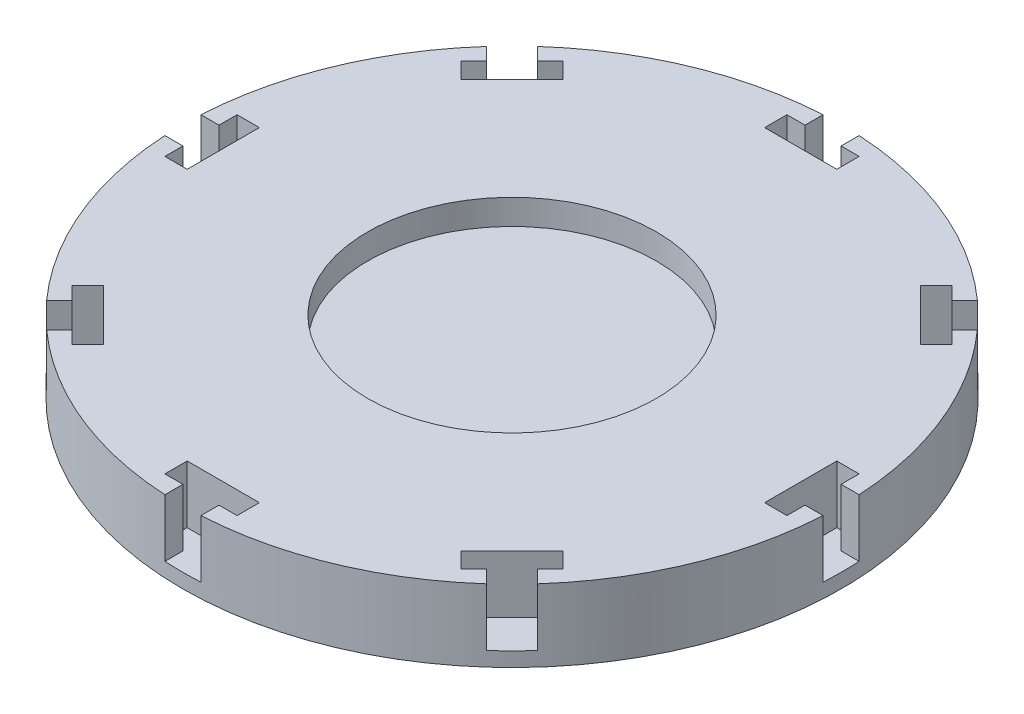
from build123d import *

# Parameters (mm, degrees)
SKETCH1_R           = 45.66
BOSS_EXTRUDE1_DEPTH = 10
SKETCH2_R           = 20
CUT_EXTRUDE1_DEPTH  = 3.5
CUT_EXTRUDE2_DEPTH  = 8
CIRPATTERN1_COUNT   = 8


with BuildPart() as part:
    # Sketch1 → Boss-Extrude1 (new body)
    with BuildSketch(Plane(origin=(0, 0, 0), x_dir=(1, 0, 0), z_dir=(0, 1, 0))):
        Circle(SKETCH1_R)
    extrude(amount=BOSS_EXTRUDE1_DEPTH)

    # Sketch2 → Cut-Extrude1 (cut)
    with BuildSketch(Plane(origin=(0, 10, 0), x_dir=(1, 0, 0), z_dir=(0, 1, 0))):
        Circle(SKETCH2_R)
    cut_extrude1 = extrude(amount=-CUT_EXTRUDE1_DEPTH, mode=Mode.SUBTRACT)

    # Mirror1: Cut-Extrude1 across plane
    add(cut_extrude1.mirror(Plane.ZX.offset(5)), mode=Mode.SUBTRACT)

    # Sketch3 → Cut-Extrude2 (cut)
    with BuildSketch(Plane(origin=(0, 10, 0), x_dir=(1, 0, 0), z_dir=(0, 1, 0))):
        Polygon((-5, -40), (5, -40), (5, -43.093913803), (2.5, -43.093913803), (2.5, -46.011189111), (-2.5, -46.011189111), (-2.5, -43.093913803), (-5, -43.093913803), align=None)
    cut_extrude2 = extrude(amount=-CUT_EXTRUDE2_DEPTH, mode=Mode.SUBTRACT)

    # CirPattern1: Cut-Extrude2 ×8 about axis
    cirpattern1_axis = Axis((0, 10, 0), (0, 1, 0))
    for i in range(1, CIRPATTERN1_COUNT):
        add(cut_extrude2.rotate(cirpattern1_axis, i * 360 / CIRPATTERN1_COUNT), mode=Mode.SUBTRACT)


solid = part.part
